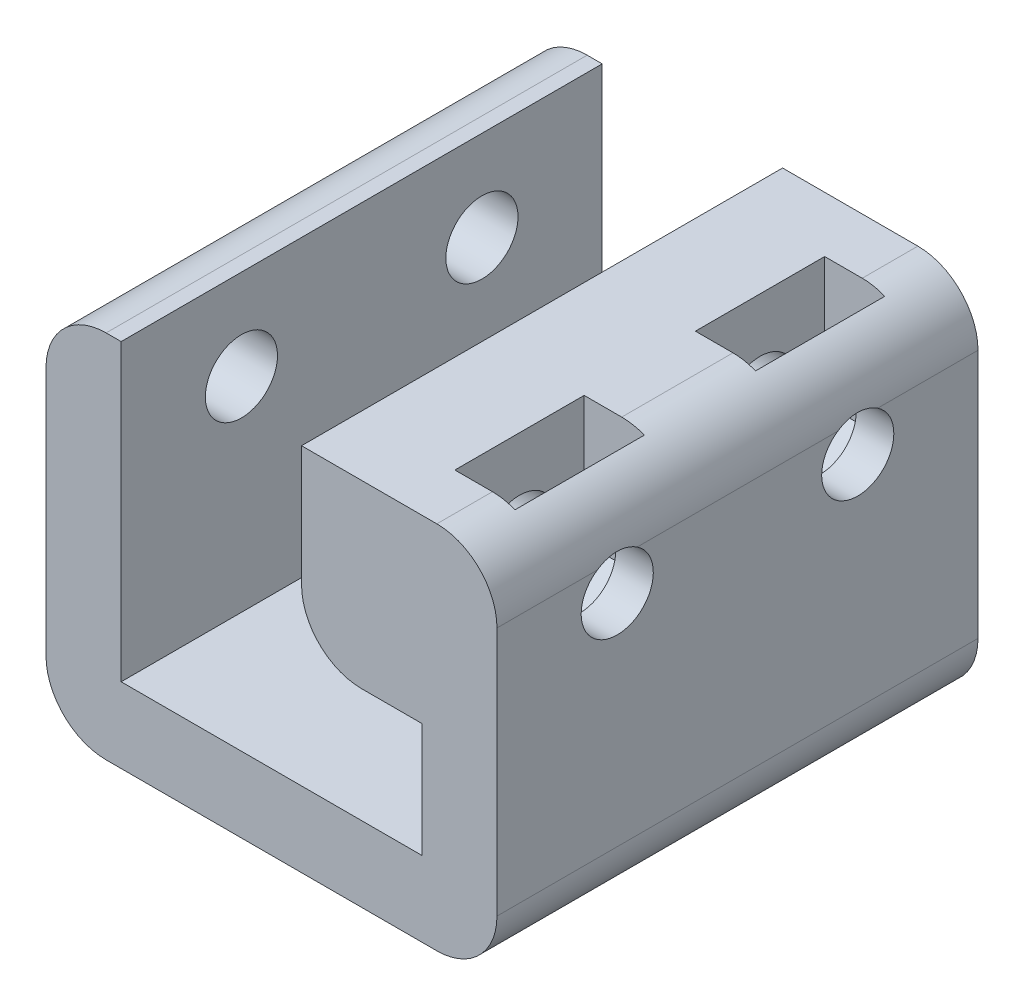
from build123d import *

# Parameters (mm, degrees)
SKETCH3_W                = 15
SKETCH3_H                = 16
BOSS_EXTRUDE1_DEPTH      = 2.5
SKETCH4_W                = 2.5
SKETCH4_H                = 16
BOSS_EXTRUDE2_DEPTH      = 9.8
M2_CLEARANCE_HOLE1_D     = 2.4
M2_CLEARANCE_HOLE1_DEPTH = 15
M2_CLEARANCE_HOLE1_TIP   = 0.721032743
FILLET1_R                = 2
BOSS_EXTRUDE3_START      = 4
SKETCH9_W                = 16
SKETCH9_H                = 6
SKETCH9_R                = 1.2
BOSS_EXTRUDE3_DEPTH      = 4
FILLET2_R                = 2
CUT_EXTRUDE1_START       = -1.25
CUT_EXTRUDE1_DEPTH       = 2


with BuildPart() as part:
    # Sketch3 → Boss-Extrude1 (new body)
    with BuildSketch(Plane(origin=(0, 0, 0), x_dir=(1, 0, 0), z_dir=(0, 1, 0))):
        Rectangle(SKETCH3_W, SKETCH3_H)
    extrude(amount=BOSS_EXTRUDE1_DEPTH)

    # Sketch4 → Boss-Extrude2 (add)
    with BuildSketch(Plane(origin=(0, 2.5, 0), x_dir=(1, 0, 0), z_dir=(0, 1, 0))):
        with Locations((-6.25, 0)):
            Rectangle(SKETCH4_W, SKETCH4_H)
        with Locations((6.25, 0)):
            Rectangle(SKETCH4_W, SKETCH4_H)
    extrude(amount=BOSS_EXTRUDE2_DEPTH)

    # M2 Clearance Hole1
    with Locations(Plane(origin=(7.5, 0, 0), x_dir=(0, 0, -1), z_dir=(1, 0, 0))):
        with Locations((-4, 9.3), (4, 9.3)):
            Hole(M2_CLEARANCE_HOLE1_D / 2, depth=M2_CLEARANCE_HOLE1_DEPTH)
            with Locations((0, 0, -(M2_CLEARANCE_HOLE1_DEPTH + M2_CLEARANCE_HOLE1_TIP / 2))):  # 118° drill point
                Cone(0, M2_CLEARANCE_HOLE1_D / 2, M2_CLEARANCE_HOLE1_TIP, mode=Mode.SUBTRACT)

    # Fillet1
    fillet1_edges = [part.edges().sort_by_distance(p)[0] for p in [
        (-7.5, 0, 0),
        (7.5, 0, 0),
    ]]
    fillet(fillet1_edges, radius=FILLET1_R)

    # Sketch9 → Boss-Extrude3 (add)
    with BuildSketch(Plane.ZY.offset(-5).offset(BOSS_EXTRUDE3_START)):
        with Locations((0, 9.3)):
            Rectangle(SKETCH9_W, SKETCH9_H)
        with Locations(Location((-4, 9.3, 0), (0, 0, 180))):
            Circle(SKETCH9_R, mode=Mode.SUBTRACT)
        with Locations(Location((4, 9.3, 0), (0, 0, 180))):
            Circle(SKETCH9_R, mode=Mode.SUBTRACT)
    extrude(amount=-BOSS_EXTRUDE3_DEPTH)

    # Fillet2
    # the kernel refuses this fillet: 2 mm, written as the material it takes off along each edge
    with BuildSketch(Plane(origin=(-7.5, 12.3, 13), x_dir=(1, 0, 0), z_dir=(0, 0, -1)), Plane(origin=(1, 6.3, 13), x_dir=(0, 1, 0), z_dir=(0, 0, -1))) as fillet2_piece_1:
        with BuildLine():
            CenterArc((FILLET2_R, FILLET2_R), FILLET2_R, 180, 90)
            Line((0, FILLET2_R), (0, 0))
            Line((0, 0), (FILLET2_R, 0))
        make_face()
    extrude(amount=26, mode=Mode.SUBTRACT)
    with BuildSketch(Plane(origin=(7.5, 12.3, -13), x_dir=(0, -1, 0), z_dir=(0, 0, 1))) as fillet2_piece_2:
        with BuildLine():
            CenterArc((FILLET2_R, -FILLET2_R), FILLET2_R, 90, 90)
            Line((0, -FILLET2_R), (0, 0))
            Line((0, 0), (FILLET2_R, 0))
        make_face()
    extrude(amount=26, mode=Mode.SUBTRACT)

    # Sketch10 → Cut-Extrude1 (cut)
    with BuildSketch(Plane(origin=(7.5, 0, 0), x_dir=(0, 0, -1), z_dir=(1, 0, 0)).offset(CUT_EXTRUDE1_START)):
        Polygon((-4, 6.817393842), (-1.85, 8.058696921), (-1.85, 10.541303079), (-1.85, 12.3), (-6.15, 12.3), (-6.15, 10.541303079), (-6.15, 8.058696921), align=None)
        Polygon((4, 6.817393842), (6.15, 8.058696921), (6.15, 10.541303079), (6.15, 12.3), (1.85, 12.3), (1.85, 10.541303079), (1.85, 8.058696921), align=None)
    extrude(amount=-CUT_EXTRUDE1_DEPTH, mode=Mode.SUBTRACT)


solid = part.part
